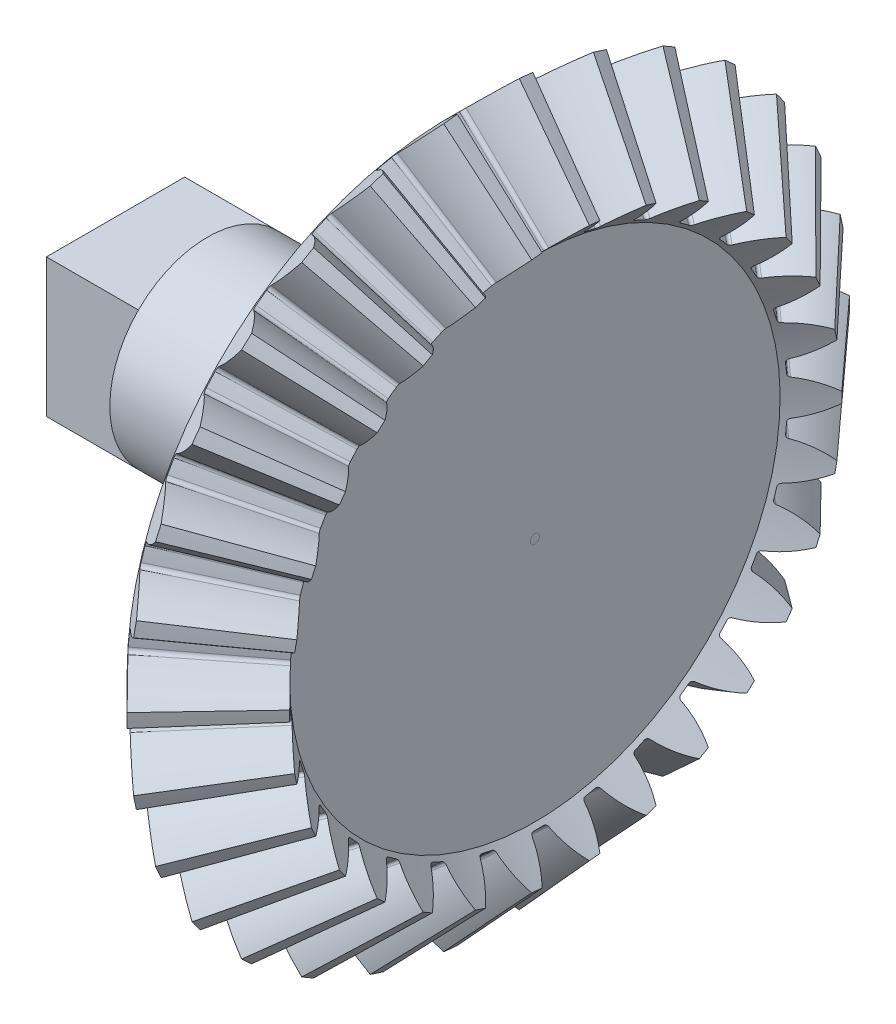
from build123d import *

# Parameters (mm, degrees)
TEETHCUTS_COUNT     = 30
TEETHCUTS_ANGLE     = 348
HUBSKE_R            = 27.899008976
HUB_DEPTH           = 17.899110576
BORSKE_R            = 0.4
BORE_DEPTH          = 50.0000508
SKETCH1_R           = 30
SKETCH1_R_2         = 8.5
CUT_EXTRUDE1_DEPTH  = 18
SKETCH2_R           = 10
BOSS_EXTRUDE1_DEPTH = 2.5
BOSS_EXTRUDE2_START = -25.465
SKETCH3_R           = 0.4
BOSS_EXTRUDE2_DEPTH = 25.465
BOSS_EXTRUDE3_START = 3
SKETCH4_R           = 8.5
BOSS_EXTRUDE3_DEPTH = 3
SKETCH5_W           = 12.02081528
SKETCH5_H           = 12.02081528
BOSS_EXTRUDE4_DEPTH = 8


with BuildPart() as part:
    # BasProSke → Base-Revolve (revolve)
    with BuildSketch(Plane(origin=(0, 0, 0), x_dir=(1, 0, 0), z_dir=(0, 1, 0)), mode=Mode.PRIVATE) as base_revolve_sk:
        Polygon((0, 0), (0, 27.899008978), (3.515204589, 31.414213561), (10.252939061, 24.00981241), (7.56627614, 21.323149493), (7.56627614, 0), align=None)
    revolve(base_revolve_sk.sketch.rotate(Axis((-10, 0, 0), (1, 0, 0)), 180), axis=Axis((-10, 0, 0), (1, 0, 0)))

    # ToothCut: read off the stored shape, not the designer's step
    # ToothCut: loft between two sections, ruled curve by curve
    toothcut_from = [
        Edge.make_bspline([(32.107368446, 0.00637742, -0.008941272), (32.103007485, 0.00201646, -0.015162265), (32.096845425, -0.0041456, -0.01427078), (32.093465486, -0.00752554, -0.006929886)], [0, 0, 0, 0, 1, 1, 1, 1], 3, [1, 0.752073194, 0.752073194, 1]),
        Edge.make_bspline([(32.093465486, -0.00752554, 0.006929886), (32.096845425, -0.0041456, 0.01427078), (32.103007485, 0.00201646, 0.015162265), (32.107368446, 0.00637742, 0.008941272)], [0, 0, 0, 0, 1, 1, 1, 1], 3, [1, 0.752073194, 0.752073194, 1]),
        Edge.make_bspline([(32.093465486, -0.00752554, -0.006929886), (32.0930377, -0.007953325, -0.006000777), (32.092699099, -0.008291926, -0.005000806), (32.092455449, -0.008535577, -0.003946997)], [0, 0, 0, 0, 1, 1, 1, 1], 3, [1, 0.994324543, 0.994324543, 1]),
        Edge.make_bspline([(32.092455449, -0.008535577, 0.003946997), (32.092699099, -0.008291926, 0.005000806), (32.0930377, -0.007953325, 0.006000777), (32.093465486, -0.00752554, 0.006929886)], [0, 0, 0, 0, 1, 1, 1, 1], 3, [1, 0.994324543, 0.994324543, 1]),
        Edge.make_bspline([(32.092455449, -0.008535577, -0.003946997), (32.091857446, -0.009133579, -0.001360583), (32.091857446, -0.009133579, 0.001360583), (32.092455449, -0.008535577, 0.003946997)], [0, 0, 0, 0, 1, 1, 1, 1], 3, [1, 0.966986355, 0.966986355, 1]),
        Edge.make_line((32.107368446, 0.00637742, 0.008941272), (32.107368446, 0.00637742, -0.008941272)),
    ]
    toothcut_to = [
        Edge.make_bspline([(3.863106025, 31.762114997, -3.1046877), (2.900203726, 30.7992127, -2.06288016), (1.803489856, 29.702498831, -1.332016289), (0.622394669, 28.521403646, -0.945037029)], [0, 0, 0, 0, 1, 1, 1, 1], 3, [1, 0.984976253, 0.984976253, 1]),
        Edge.make_bspline([(0.622394669, 28.521403646, 0.945037029), (1.803489856, 29.702498831, 1.332016289), (2.900203726, 30.7992127, 2.06288016), (3.863106025, 31.762114997, 3.1046877)], [0, 0, 0, 0, 1, 1, 1, 1], 3, [1, 0.984976253, 0.984976253, 1]),
        Edge.make_bspline([(0.622394669, 28.521403646, -0.945037029), (0.494159042, 28.39316802, -0.90302134), (0.413323338, 28.312332315, -0.756102152), (0.416039497, 28.315048475, -0.56998575)], [0, 0, 0, 0, 1, 1, 1, 1], 3, [1, 0.850924202, 0.850924202, 1]),
        Edge.make_bspline([(0.416039497, 28.315048475, 0.56998575), (0.413323338, 28.312332315, 0.756102152), (0.494159042, 28.39316802, 0.90302134), (0.622394669, 28.521403646, 0.945037029)], [0, 0, 0, 0, 1, 1, 1, 1], 3, [1, 0.850924202, 0.850924202, 1]),
        Edge.make_bspline([(0.416039497, 28.315048475, -0.56998575), (0.421584638, 28.320593615, -0.190022222), (0.421584638, 28.320593615, 0.190022222), (0.416039497, 28.315048475, 0.56998575)], [0, 0, 0, 0, 1, 1, 1, 1], 3, [1, 0.999858058, 0.999858058, 1]),
        Edge.make_line((3.863106025, 31.762114997, 3.1046877), (3.863106025, 31.762114997, -3.1046877)),
    ]
    toothcut = Solid(Shell([*[Face.make_surface_from_curves(toothcut_from[k], toothcut_to[k]) for k in range(6)], Face(Wire(toothcut_from)), Face(Wire(toothcut_to))]))
    add(toothcut, mode=Mode.SUBTRACT)

    # TeethCuts: ToothCut ×30 about axis
    teethcuts_axis = Axis((-10, 0, 0), (1, 0, 0))
    for i in range(1, TEETHCUTS_COUNT):
        add(toothcut.rotate(teethcuts_axis, i * TEETHCUTS_ANGLE / (TEETHCUTS_COUNT - 1)), mode=Mode.SUBTRACT)

    # HubSke → Hub (add)
    with BuildSketch(Plane.ZY):
        Circle(HUBSKE_R)
    extrude(amount=HUB_DEPTH)

    # BorSke → Bore (cut, symmetric)
    with BuildSketch(Plane(origin=(0, 0, 0), x_dir=(0, 0, -1), z_dir=(1, 0, 0))):
        with Locations(Location((0, 0, 0), (0, 0, 180))):
            Circle(BORSKE_R)
    extrude(amount=BORE_DEPTH, both=True, mode=Mode.SUBTRACT)

    # Sketch1 → Cut-Extrude1 (cut)
    with BuildSketch(Plane.ZY.offset(17.899110576)):
        Circle(SKETCH1_R)
        Circle(SKETCH1_R_2, mode=Mode.SUBTRACT)
    extrude(amount=-CUT_EXTRUDE1_DEPTH, mode=Mode.SUBTRACT)

    # Sketch2 → Boss-Extrude1 (add)
    with BuildSketch(Plane.ZY.offset(-0.100889424)):
        Circle(SKETCH2_R)
    extrude(amount=BOSS_EXTRUDE1_DEPTH)

    # Sketch3 → Boss-Extrude2 (add)
    with BuildSketch(Plane.ZY.offset(17.899110576).offset(BOSS_EXTRUDE2_START)):
        Circle(SKETCH3_R)
    extrude(amount=BOSS_EXTRUDE2_DEPTH)

    # Sketch4 → Boss-Extrude3 (add)
    with BuildSketch(Plane.ZY.offset(17.899110576).offset(BOSS_EXTRUDE3_START)):
        Circle(SKETCH4_R)
    extrude(amount=-BOSS_EXTRUDE3_DEPTH)

    # Sketch5 → Boss-Extrude4 (add)
    with BuildSketch(Plane.ZY.offset(20.899110576)):
        Rectangle(SKETCH5_W, SKETCH5_H)
    extrude(amount=BOSS_EXTRUDE4_DEPTH)


solid = part.part
